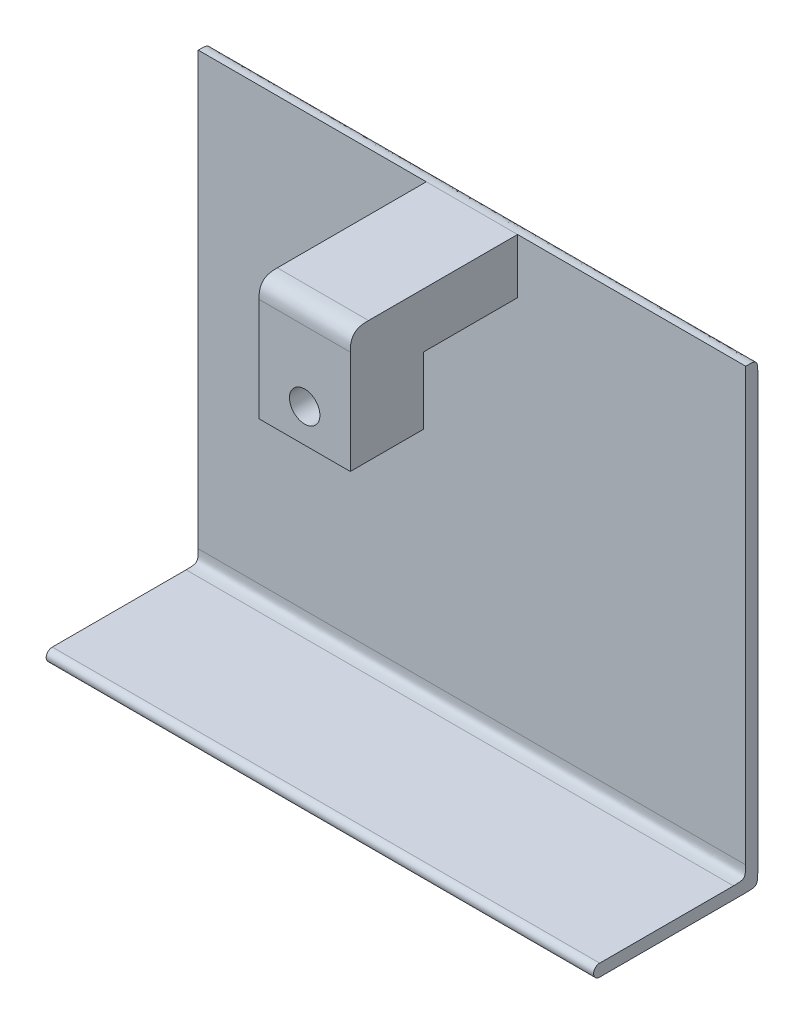
from build123d import *

# Parameters (mm, degrees)
SKETCH1_W           = 75
SKETCH1_H           = 60
BOSS_EXTRUDE2_DEPTH = 100
SKETCH2_W           = 75
SKETCH2_H           = 45
BOSS_EXTRUDE3_DEPTH = 77.5
BOSS_EXTRUDE4_DEPTH = 10
SKETCH4_W           = 450
SKETCH4_H           = 10
BOSS_EXTRUDE5_DEPTH = 125
SKETCH5_R           = 12.5
CUT_EXTRUDE1_DEPTH  = 125
FILLET3_SIZE        = 10
FILLET4_RADIUS      = 5
FILLET4_LENGTH      = 450
FILLET5_SIZE        = 10
FILLET6_SIZE        = 15


with BuildPart() as part:
    # Sketch1 → Boss-Extrude2 (new body)
    with BuildSketch(Plane(origin=(0, 0, 0), x_dir=(1, 0, 0), z_dir=(0, 1, 0))):
        Rectangle(SKETCH1_W, SKETCH1_H)
    extrude(amount=BOSS_EXTRUDE2_DEPTH)

    # Sketch2 → Boss-Extrude3 (add)
    with BuildSketch(Plane(origin=(0, 0, -30), x_dir=(-1, 0, 0), z_dir=(0, 0, -1))):
        with Locations((0, 77.5)):
            Rectangle(SKETCH2_W, SKETCH2_H)
    extrude(amount=BOSS_EXTRUDE3_DEPTH)

    # Sketch3 → Boss-Extrude4 (add)
    with BuildSketch(Plane(origin=(0, 0, -107.5), x_dir=(-1, 0, 0), z_dir=(0, 0, -1))):
        Polygon((0, 100), (225, 100), (225, -275), (25, -275), (-225, -275), (-225, 100), align=None)
    extrude(amount=BOSS_EXTRUDE4_DEPTH)

    # Sketch4 → Boss-Extrude5 (add)
    with BuildSketch(Plane.XY.offset(-107.5)):
        with Locations((0, -270)):
            Rectangle(SKETCH4_W, SKETCH4_H)
    extrude(amount=BOSS_EXTRUDE5_DEPTH)

    # Sketch5 → Cut-Extrude1 (cut)
    with BuildSketch(Plane.XY.offset(30)):
        with Locations((0, 27.501368098)):
            Circle(SKETCH5_R)
    extrude(amount=-CUT_EXTRUDE1_DEPTH, mode=Mode.SUBTRACT)

    # Fillet3
    # a fillet whose section is not a circle: 10 mm, written as the material it takes off along each edge
    with BuildSketch(Plane(origin=(-250, -275, -117.5), x_dir=(0, 1, 0), z_dir=(1, 0, 0))) as fillet3_piece_1:
        with BuildLine():
            Bezier((FILLET3_SIZE, 0), (0, 0), (0, FILLET3_SIZE), weights=[1, 2.333333333, 1])
            Line((0, FILLET3_SIZE), (0, 0))
            Line((0, 0), (FILLET3_SIZE, 0))
        make_face()
    extrude(amount=500, mode=Mode.SUBTRACT)
    with BuildSketch(Plane(origin=(250, 100, -117.5), x_dir=(0, 0, 1), z_dir=(-1, 0, 0))) as fillet3_piece_2:
        with BuildLine():
            Bezier((FILLET3_SIZE, 0), (0, 0), (0, -FILLET3_SIZE), weights=[1, 2.333333333, 1])
            Line((0, -FILLET3_SIZE), (0, 0))
            Line((0, 0), (FILLET3_SIZE, 0))
        make_face()
    extrude(amount=500, mode=Mode.SUBTRACT)

    # Fillet4: full round fillet: the end face becomes a half cylinder, R = half its width
    fillet4_face = Plane((0, -270, 17.5), x_dir=(1, 0, 0), z_dir=(0, 0, 1))  # on the end face: x along it, z out of the body
    fillet4_slab = fillet4_face.offset(-FILLET4_RADIUS / 2) * Box(FILLET4_LENGTH, 2 * FILLET4_RADIUS, FILLET4_RADIUS, mode=Mode.PRIVATE)  # the body's end, R deep
    fillet4_round = Plane((0, -270, 12.5), x_dir=(0, 0, 1), z_dir=(1, 0, 0)) * Cylinder(FILLET4_RADIUS, FILLET4_LENGTH, mode=Mode.PRIVATE)  # its axis R under the face
    add(fillet4_slab - fillet4_round, mode=Mode.SUBTRACT)

    # Fillet5
    # a fillet whose section is not a circle: 10 mm, written as the material it adds along each edge
    with BuildSketch(Plane(origin=(225, -265, -107.5), x_dir=(0, 1, 0), z_dir=(-1, 0, 0))) as fillet5_piece_1:
        with BuildLine():
            Bezier((FILLET5_SIZE, 0), (0, 0), (0, -FILLET5_SIZE), weights=[1, 2.333333333, 1])
            Line((0, -FILLET5_SIZE), (-FILLET5_SIZE * 0.02, -FILLET5_SIZE))
            Line((-FILLET5_SIZE * 0.02, -FILLET5_SIZE), (-FILLET5_SIZE * 0.02, FILLET5_SIZE * 0.02))
            Line((-FILLET5_SIZE * 0.02, FILLET5_SIZE * 0.02), (FILLET5_SIZE, FILLET5_SIZE * 0.02))
            Line((FILLET5_SIZE, FILLET5_SIZE * 0.02), (FILLET5_SIZE, 0))
        make_face()
    extrude(amount=450)

    # Fillet6
    # a fillet whose section is not a circle: 15 mm, written as the material it takes off along each edge
    with BuildSketch(Plane(origin=(-75, 100, 30), x_dir=(0, 0, -1), z_dir=(1, 0, 0))) as fillet6_piece_1:
        with BuildLine():
            add(Edge.make_bspline([(FILLET6_SIZE, 0), (FILLET6_SIZE * 0.831801948466, 0), (FILLET6_SIZE * 0.663603896932, 0), (FILLET6_SIZE * 0.292893218813, -FILLET6_SIZE * 0.0716919198361), (FILLET6_SIZE * 0.0716919198361, -FILLET6_SIZE * 0.292893218813), (0, -FILLET6_SIZE * 0.663603896932), (0, -FILLET6_SIZE * 0.831801948466), (0, -FILLET6_SIZE)], knots=[0, 0, 0, 0, 0, 0, 0.5, 0.5, 1, 1, 1, 1, 1, 1], degree=5))
            Line((0, -FILLET6_SIZE), (0, 0))
            Line((0, 0), (FILLET6_SIZE, 0))
        make_face()
    extrude(amount=150, mode=Mode.SUBTRACT)


solid = part.part
